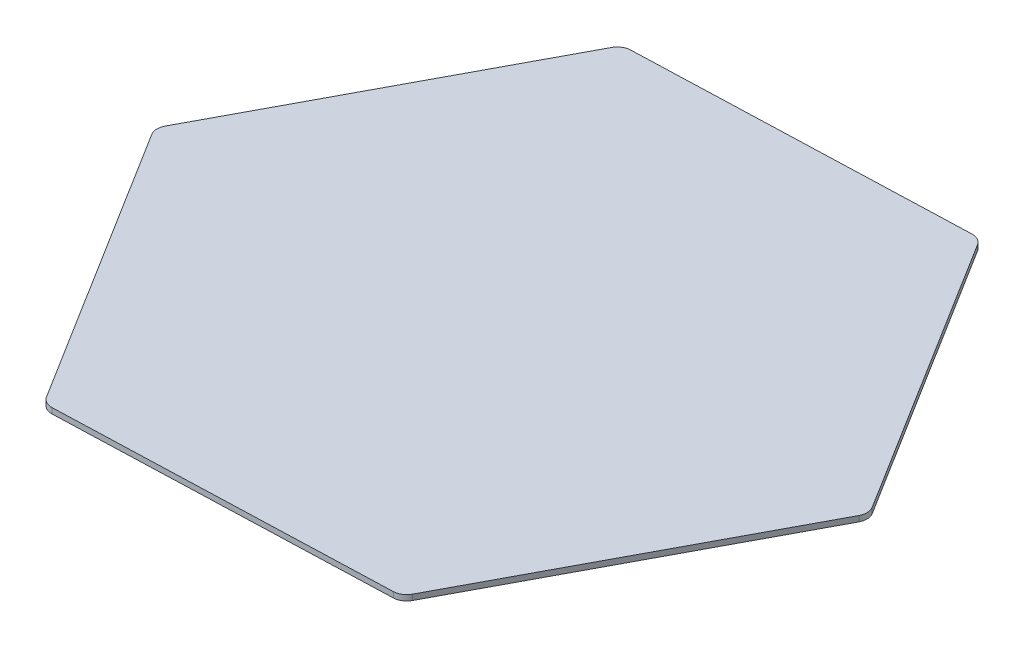
from build123d import *

# Parameters (mm, degrees)
BOSS_EXTRUDE1_DEPTH = 2
FILLET1_R           = 5


with BuildPart() as part:
    # Sketch1 → Boss-Extrude1 (new body)
    with BuildSketch(Plane(origin=(0, 0, 0), x_dir=(1, 0, 0), z_dir=(0, 1, 0))):
        Polygon((66.023184796, 2.26695686), (190.657396138, 6.546368422), (249.268422683, 116.622467405), (183.245237886, 222.419154826), (58.611026545, 218.139743264), (0, 108.063644281), align=None)
    extrude(amount=BOSS_EXTRUDE1_DEPTH)

    # Fillet1
    fillet1_edges = [part.edges().sort_by_distance(p)[0] for p in [
        (0, 1, -108.063644281),
        (58.611026545, 1, -218.139743264),
        (183.245237886, 1, -222.419154826),
        (249.268422683, 1, -116.622467405),
        (66.023184796, 1, -2.26695686),
        (190.657396138, 1, -6.546368422),
    ]]
    fillet(fillet1_edges, radius=FILLET1_R)


solid = part.part
